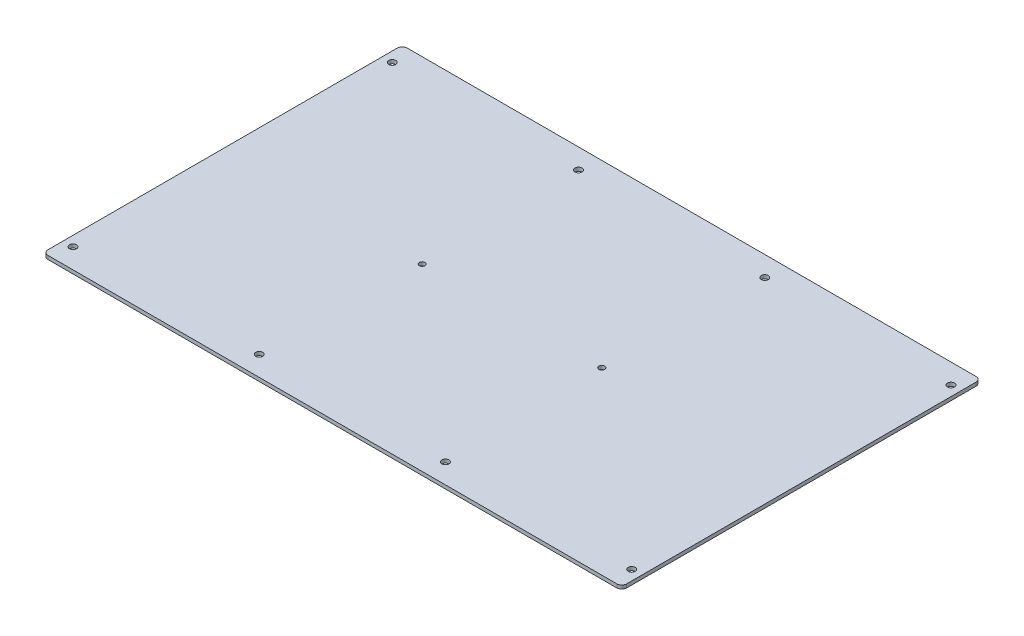
from build123d import *

# Parameters (mm, degrees)
SKETCH1_R           = 2.2479
SKETCH1_R_2         = 1.8288
BOSS_EXTRUDE1_DEPTH = 2.286


with BuildPart() as part:
    # Sketch1 → Boss-Extrude1 (new body)
    with BuildSketch(Plane(origin=(0, 0, 0), x_dir=(1, 0, 0), z_dir=(0, 1, 0))):
        with BuildLine():
            Line((-180.975, 114.3), (180.975, 114.3))
            ThreePointArc((180.975, 114.3), (183.22006403, 113.37006403), (184.15, 111.125))
            Line((184.15, 111.125), (184.15, -111.125))
            ThreePointArc((184.15, -111.125), (183.22006403, -113.37006403), (180.975, -114.3))
            Line((180.975, -114.3), (-180.975, -114.3))
            ThreePointArc((-180.975, -114.3), (-183.22006403, -113.37006403), (-184.15, -111.125))
            Line((-184.15, -111.125), (-184.15, 111.125))
            ThreePointArc((-184.15, 111.125), (-183.22006403, 113.37006403), (-180.975, 114.3))
        make_face()
        with Locations((-177.8, 101.6)):
            Circle(SKETCH1_R, mode=Mode.SUBTRACT)
        with Locations((-59.266666667, 101.6)):
            Circle(SKETCH1_R, mode=Mode.SUBTRACT)
        with Locations((59.266666667, 101.6)):
            Circle(SKETCH1_R, mode=Mode.SUBTRACT)
        with Locations((177.8, 101.6)):
            Circle(SKETCH1_R, mode=Mode.SUBTRACT)
        with Locations((177.8, -101.6)):
            Circle(SKETCH1_R, mode=Mode.SUBTRACT)
        with Locations((59.266666667, -101.6)):
            Circle(SKETCH1_R, mode=Mode.SUBTRACT)
        with Locations((-59.266666667, -101.6)):
            Circle(SKETCH1_R, mode=Mode.SUBTRACT)
        with Locations((-177.8, -101.6)):
            Circle(SKETCH1_R, mode=Mode.SUBTRACT)
        with Locations((-57.15, 0)):
            Circle(SKETCH1_R_2, mode=Mode.SUBTRACT)
        with Locations((57.15, 0)):
            Circle(SKETCH1_R_2, mode=Mode.SUBTRACT)
    extrude(amount=BOSS_EXTRUDE1_DEPTH)


solid = part.part
